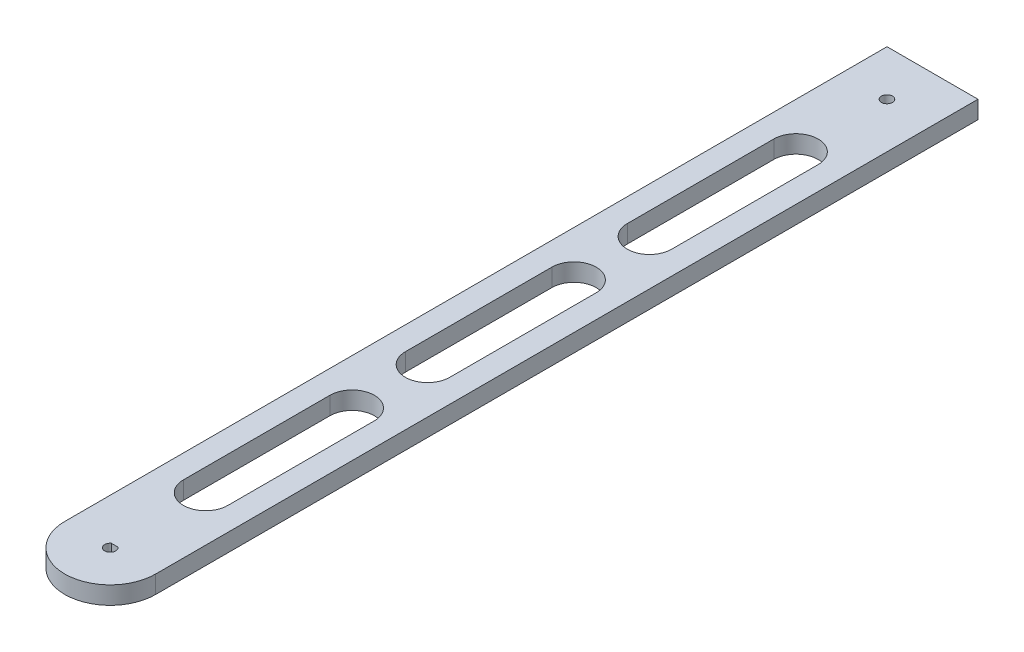
from build123d import *

# Parameters (mm, degrees)
ZAPAS_CZ_1_0_1_START        = 21.1
ZAPAS_CZ_1_0_1_DEPTH        = 8
WYTNIJ_WYCI_GNI_CIE1_DEPTH  = 393.717022804
DODANIE_WYCI_GNI_CIE1_DEPTH = 8


# Read off the part's stored shape, not the designer's step: Zapas-Część1.0-1
with BuildPart() as part:
    # Zapas-Część1.0-1 outline → Zapas-Część1.0-1 (new body)
    with BuildSketch(Plane(origin=(0, 0, 0), x_dir=(1, 0, 0), z_dir=(0, 1, 0)).offset(ZAPAS_CZ_1_0_1_START)):
        with BuildLine():
            ThreePointArc((-20.5, 21.6), (0, 1.1), (20.5, 21.6))
            Line((20.5, 21.6), (20.5, 371.6))
            ThreePointArc((20.5, 371.6), (0, 392.1), (-20.5, 371.6))
            Line((-20.5, 371.6), (-20.5, 21.6))
        make_face()
        with BuildLine():
            Line((-10, 64.6), (-10, 130.6))
            ThreePointArc((-10, 130.6), (0, 140.6), (10, 130.6))
            Line((10, 130.6), (10, 64.6))
            ThreePointArc((10, 64.6), (0, 54.6), (-10, 64.6))
        make_face(mode=Mode.SUBTRACT)
        with BuildLine():
            Line((-10, 164.6), (-10, 230.6))
            ThreePointArc((-10, 230.6), (0, 240.6), (10, 230.6))
            Line((10, 230.6), (10, 164.6))
            ThreePointArc((10, 164.6), (0, 154.6), (-10, 164.6))
        make_face(mode=Mode.SUBTRACT)
        with BuildLine():
            Line((-10, 264.6), (-10, 330.6))
            ThreePointArc((-10, 330.6), (0, 340.6), (10, 330.6))
            Line((10, 330.6), (10, 264.6))
            ThreePointArc((10, 264.6), (0, 254.6), (-10, 264.6))
        make_face(mode=Mode.SUBTRACT)
    extrude(amount=ZAPAS_CZ_1_0_1_DEPTH)

    # Szkic1 → Wytnij-wyciągnięcie1 (cut, through all)
    with BuildSketch(Plane(origin=(0, 29.1, 0), x_dir=(1, 0, 0), z_dir=(0, 1, 0))):
        with BuildLine():
            Line((-1.5, 23.6), (1.5, 23.6))
            ThreePointArc((1.5, 23.6), (0, 19.1), (-1.5, 23.6))
        make_face()
        with BuildLine():
            ThreePointArc((2.5, 371.6), (-1.118033989, 373.836067977), (-1.5, 369.6))
            ThreePointArc((-1.5, 369.6), (0, 369.1), (1.5, 369.6))
            ThreePointArc((1.5, 369.6), (2.236067977, 370.481966011), (2.5, 371.6))
        make_face()
    extrude(amount=-WYTNIJ_WYCI_GNI_CIE1_DEPTH, mode=Mode.SUBTRACT)

    # Szkic2 → Dodanie-wyciągnięcie1 (add)
    with BuildSketch(Plane(origin=(0, 29.1, 0), x_dir=(1, 0, 0), z_dir=(0, 1, 0))):
        with BuildLine():
            Line((-20.5, 371.6), (-20.5, 392.131331169))
            Line((-20.5, 392.131331169), (20.5, 392.131331169))
            Line((20.5, 392.131331169), (20.5, 371.6))
            Line((20.5, 371.6), (3.983153472, 371.6))
            Line((3.983153472, 371.6), (2.5, 371.6))
            ThreePointArc((2.5, 371.6), (0, 374.1), (-2.5, 371.6))
            Line((-2.5, 371.6), (-20.5, 371.6))
        make_face()
    extrude(amount=-DODANIE_WYCI_GNI_CIE1_DEPTH)


solid = part.part
